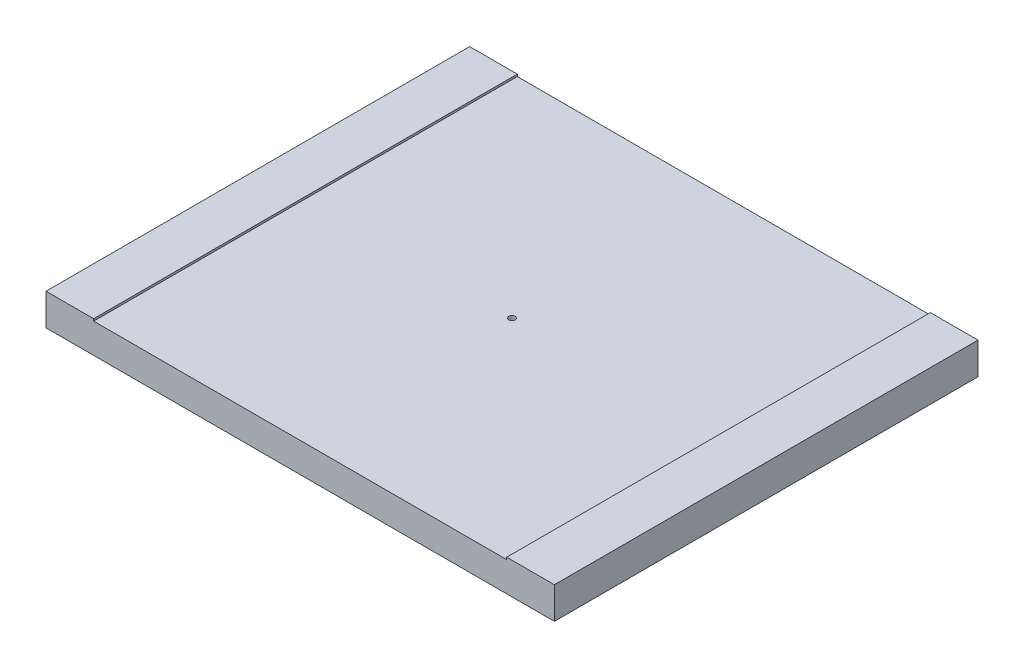
from build123d import *

# Parameters (mm, degrees)
SKETCH1_W           = 240
SKETCH1_H           = 200
BOSS_EXTRUDE1_DEPTH = 7.5
SKETCH2_R           = 1.5
CUT_EXTRUDE1_DEPTH  = 157.923548265
CUT_EXTRUDE2_DEPTH  = 1


with BuildPart() as part:
    # Sketch1 → Boss-Extrude1 (new, symmetric)
    with BuildSketch(Plane(origin=(0, 0, 0), x_dir=(1, 0, 0), z_dir=(0, 1, 0))):
        Rectangle(SKETCH1_W, SKETCH1_H)
    extrude(amount=BOSS_EXTRUDE1_DEPTH, both=True)

    # Sketch2 → Cut-Extrude1 (cut, through all)
    with BuildSketch(Plane(origin=(0, 7.5, 0), x_dir=(1, 0, 0), z_dir=(0, 1, 0))):
        Circle(SKETCH2_R)
    extrude(amount=-CUT_EXTRUDE1_DEPTH, mode=Mode.SUBTRACT)

    # Sketch3 → Cut-Extrude2 (cut)
    with BuildSketch(Plane(origin=(0, 7.5, 0), x_dir=(1, 0, 0), z_dir=(0, 1, 0))):
        with BuildLine():
            Line((-92.5, -105), (92.5, -105))
            ThreePointArc((92.5, -105), (96.035533906, -103.535533906), (97.5, -100))
            Line((97.5, -100), (97.5, 100))
            ThreePointArc((97.5, 100), (96.035533906, 103.535533906), (92.5, 105))
            Line((92.5, 105), (-92.5, 105))
            ThreePointArc((-92.5, 105), (-96.035533906, 103.535533906), (-97.5, 100))
            Line((-97.5, 100), (-97.5, -100))
            ThreePointArc((-97.5, -100), (-96.035533906, -103.535533906), (-92.5, -105))
        make_face()
    extrude(amount=-CUT_EXTRUDE2_DEPTH, mode=Mode.SUBTRACT)


solid = part.part
